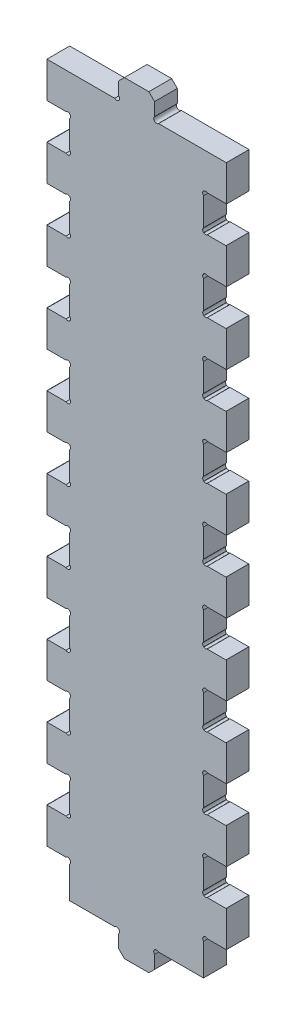
from build123d import *

# Parameters (mm, degrees)
BOSS_EXTRUDE1_DEPTH = 6.35
CHAMFER1_SIZE       = 1.5875
SKETCH1_W           = 6.31593513
SKETCH1_H           = 10.068268446
SKETCH1_W_2         = 6.289133039
SKETCH1_H_2         = 10.1524
CUT_EXTRUDE1_DEPTH  = 6.35
LPATTERN1_COUNT     = 9
LPATTERN1_PITCH     = 20


# Read off the part's stored shape, not the designer's step: Boss-Extrude1
with BuildPart() as part:
    # Boss-Extrude1 outline → Boss-Extrude1 (new body)
    with BuildSketch(Plane.XY):
        with BuildLine():
            Line((-6.35, 190), (-1.066002504, 190))
            ThreePointArc((-1.066002504, 190), (0.02634773, 189.921017806), (0, 188.826132873))
            Line((0, 188.826132873), (0, 181.122532015))
            ThreePointArc((0, 181.122532015), (0, 180), (-1.122532015, 180))
            Line((-1.122532015, 180), (-6.35, 180))
            Line((-6.35, 180), (-6.35, 170))
            Line((-6.35, 170), (-1.122532015, 170))
            ThreePointArc((-1.122532015, 170), (0, 170), (0, 168.877467985))
            Line((0, 168.877467985), (0, 161.122532015))
            ThreePointArc((0, 161.122532015), (0, 160), (-1.122532015, 160))
            Line((-1.122532015, 160), (-6.35, 160))
            Line((-6.35, 160), (-6.35, 150))
            Line((-6.35, 150), (-1.122532015, 150))
            ThreePointArc((-1.122532015, 150), (0, 150), (0, 148.877467985))
            Line((0, 148.877467985), (0, 141.122532015))
            ThreePointArc((0, 141.122532015), (0, 140), (-1.122532015, 140))
            Line((-1.122532015, 140), (-6.35, 140))
            Line((-6.35, 140), (-6.35, 130))
            Line((-6.35, 130), (-1.122532015, 130))
            ThreePointArc((-1.122532015, 130), (0, 130), (0, 128.877467985))
            Line((0, 128.877467985), (0, 121.122532015))
            ThreePointArc((0, 121.122532015), (0, 120), (-1.122532015, 120))
            Line((-1.122532015, 120), (-6.35, 120))
            Line((-6.35, 120), (-6.35, 110))
            Line((-6.35, 110), (-1.122532015, 110))
            ThreePointArc((-1.122532015, 110), (0, 110), (0, 108.877467985))
            Line((0, 108.877467985), (0, 101.122532015))
            ThreePointArc((0, 101.122532015), (0, 100), (-1.122532015, 100))
            Line((-1.122532015, 100), (-6.35, 100))
            Line((-6.35, 100), (-6.35, 90))
            Line((-6.35, 90), (-1.122532015, 90))
            ThreePointArc((-1.122532015, 90), (0, 90), (0, 88.877467985))
            Line((0, 88.877467985), (0, 81.122532015))
            ThreePointArc((0, 81.122532015), (0, 80), (-1.122532015, 80))
            Line((-1.122532015, 80), (-6.35, 80))
            Line((-6.35, 80), (-6.35, 70))
            Line((-6.35, 70), (-1.122532015, 70))
            ThreePointArc((-1.122532015, 70), (0, 70), (0, 68.877467985))
            Line((0, 68.877467985), (0, 61.122532015))
            ThreePointArc((0, 61.122532015), (0, 60), (-1.122532015, 60))
            Line((-1.122532015, 60), (-6.35, 60))
            Line((-6.35, 60), (-6.35, 50))
            Line((-6.35, 50), (-1.122532015, 50))
            ThreePointArc((-1.122532015, 50), (0, 50), (0, 48.877467985))
            Line((0, 48.877467985), (0, 41.122532015))
            ThreePointArc((0, 41.122532015), (0, 40), (-1.122532015, 40))
            Line((-1.122532015, 40), (-6.35, 40))
            Line((-6.35, 40), (-6.35, 30))
            Line((-6.35, 30), (-1.122532015, 30))
            ThreePointArc((-1.122532015, 30), (0, 30), (0, 28.877467985))
            Line((0, 28.877467985), (0, 21.122532015))
            ThreePointArc((0, 21.122532015), (0, 20), (-1.122532015, 20))
            Line((-1.122532015, 20), (-6.35, 20))
            Line((-6.35, 20), (-6.35, 10))
            Line((-6.35, 10), (-1.122532015, 10))
            ThreePointArc((-1.122532015, 10), (0, 10), (0, 8.877467985))
            Line((0, 8.877467985), (0, 0))
            Line((0, 0), (12.527467985, 0))
            ThreePointArc((12.527467985, 0), (13.65, 0), (13.65, -1.122532015))
            Line((13.65, -1.122532015), (13.65, -6.35))
            Line((13.65, -6.35), (23.65, -6.35))
            Line((23.65, -6.35), (23.65, -1.122532015))
            ThreePointArc((23.65, -1.122532015), (23.65, 0), (24.772532015, 0))
            Line((24.772532015, 0), (37.3, 0))
            Line((37.3, 0), (37.3, 8.877467985))
            ThreePointArc((37.3, 8.877467985), (37.3, 10), (38.422532015, 10))
            Line((38.422532015, 10), (43.65, 10))
            Line((43.65, 10), (43.65, 20))
            Line((43.65, 20), (38.422532015, 20))
            ThreePointArc((38.422532015, 20), (37.3, 20), (37.3, 21.122532015))
            Line((37.3, 21.122532015), (37.3, 28.877467985))
            ThreePointArc((37.3, 28.877467985), (37.3, 30), (38.422532015, 30))
            Line((38.422532015, 30), (43.65, 30))
            Line((43.65, 30), (43.65, 40))
            Line((43.65, 40), (38.422532015, 40))
            ThreePointArc((38.422532015, 40), (37.3, 40), (37.3, 41.122532015))
            Line((37.3, 41.122532015), (37.3, 48.877467985))
            ThreePointArc((37.3, 48.877467985), (37.3, 50), (38.422532015, 50))
            Line((38.422532015, 50), (43.65, 50))
            Line((43.65, 50), (43.65, 60))
            Line((43.65, 60), (38.422532015, 60))
            ThreePointArc((38.422532015, 60), (37.3, 60), (37.3, 61.122532015))
            Line((37.3, 61.122532015), (37.3, 68.877467985))
            ThreePointArc((37.3, 68.877467985), (37.3, 70), (38.422532015, 70))
            Line((38.422532015, 70), (43.65, 70))
            Line((43.65, 70), (43.65, 80))
            Line((43.65, 80), (38.422532015, 80))
            ThreePointArc((38.422532015, 80), (37.3, 80), (37.3, 81.122532015))
            Line((37.3, 81.122532015), (37.3, 88.877467985))
            ThreePointArc((37.3, 88.877467985), (37.3, 90), (38.422532015, 90))
            Line((38.422532015, 90), (43.65, 90))
            Line((43.65, 90), (43.65, 100))
            Line((43.65, 100), (38.422532015, 100))
            ThreePointArc((38.422532015, 100), (37.3, 100), (37.3, 101.122532015))
            Line((37.3, 101.122532015), (37.3, 108.877467985))
            ThreePointArc((37.3, 108.877467985), (37.3, 110), (38.422532015, 110))
            Line((38.422532015, 110), (43.65, 110))
            Line((43.65, 110), (43.65, 120))
            Line((43.65, 120), (38.422532015, 120))
            ThreePointArc((38.422532015, 120), (37.3, 120), (37.3, 121.122532015))
            Line((37.3, 121.122532015), (37.3, 128.877467985))
            ThreePointArc((37.3, 128.877467985), (37.3, 130), (38.422532015, 130))
            Line((38.422532015, 130), (43.65, 130))
            Line((43.65, 130), (43.65, 140))
            Line((43.65, 140), (38.422532015, 140))
            ThreePointArc((38.422532015, 140), (37.3, 140), (37.3, 141.122532015))
            Line((37.3, 141.122532015), (37.3, 148.877467985))
            ThreePointArc((37.3, 148.877467985), (37.3, 150), (38.422532015, 150))
            Line((38.422532015, 150), (43.65, 150))
            Line((43.65, 150), (43.65, 160))
            Line((43.65, 160), (38.422532015, 160))
            ThreePointArc((38.422532015, 160), (37.3, 160), (37.3, 161.122532015))
            Line((37.3, 161.122532015), (37.3, 168.877467985))
            ThreePointArc((37.3, 168.877467985), (37.3, 170), (38.422532015, 170))
            Line((38.422532015, 170), (43.65, 170))
            Line((43.65, 170), (43.65, 180))
            Line((43.65, 180), (38.422532015, 180))
            ThreePointArc((38.422532015, 180), (37.3, 180), (37.3, 181.122532015))
            Line((37.3, 181.122532015), (37.3, 188.877467985))
            ThreePointArc((37.3, 188.877467985), (37.3, 190), (38.422532015, 190))
            Line((38.422532015, 190), (43.65, 190))
            Line((43.65, 190), (43.65, 200))
            Line((43.65, 200), (24.772532015, 200))
            ThreePointArc((24.772532015, 200), (23.65, 200), (23.65, 201.122532015))
            Line((23.65, 201.122532015), (23.65, 206.35))
            Line((23.65, 206.35), (13.65, 206.35))
            Line((13.65, 206.35), (13.65, 201.122532015))
            ThreePointArc((13.65, 201.122532015), (13.65, 200), (12.527467985, 200))
            Line((12.527467985, 200), (-6.35, 200))
            Line((-6.35, 200), (-6.35, 190))
        make_face()
    extrude(amount=BOSS_EXTRUDE1_DEPTH)

    # Chamfer1
    chamfer1_edges = [part.edges().sort_by_distance(p)[0] for p in [
        (13.65, 206.35, 3.175),
        (23.65, 206.35, 3.175),
        (23.65, -6.35, 3.175),
        (13.65, -6.35, 3.175),
    ]]
    chamfer(chamfer1_edges, length=CHAMFER1_SIZE)

    # Sketch1 → Cut-Extrude1 (cut)
    with BuildSketch(Plane.XY.offset(6.35)):
        with Locations((-3.175002191, 184.974332444)):
            Rectangle(SKETCH1_W, SKETCH1_H)
        with Locations((40.474994567, 185)):
            Rectangle(SKETCH1_W_2, SKETCH1_H_2)
    cut_extrude1 = extrude(amount=-CUT_EXTRUDE1_DEPTH, mode=Mode.SUBTRACT)

    # LPattern1: Cut-Extrude1 ×9
    with Locations(*[(0, -i * LPATTERN1_PITCH, 0) for i in range(1, LPATTERN1_COUNT)]):
        add(cut_extrude1, mode=Mode.SUBTRACT)


solid = part.part
